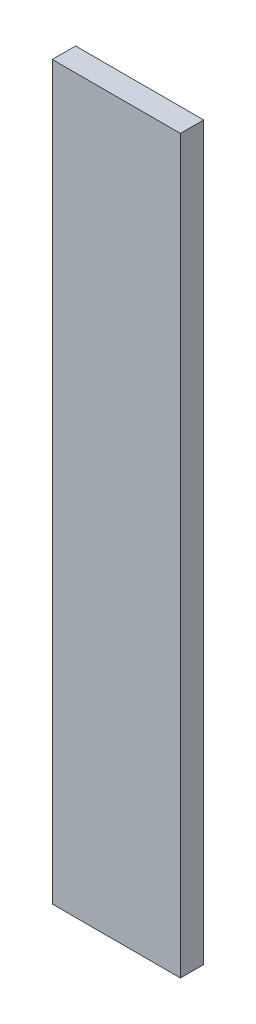
from build123d import *

# Parameters (mm, degrees)
SKETCH1_W                       = 39
SKETCH1_H                       = 155
BOSS_EXTRUDE1_DEPTH             = 2
BOSS_EXTRUDE2_DEPTH             = 78
SKETCH3_W                       = 2
SKETCH3_H                       = 2
BOSS_EXTRUDE3_DEPTH             = 78
SKETCH4_W                       = 2
SKETCH4_H                       = 2
BOSS_EXTRUDE4_DEPTH             = 151
SKETCH6_W                       = 35
SKETCH6_H                       = 2.2
CUT_EXTRUDE1_DEPTH              = 174.750539568
SKETCH7_W                       = 35
SKETCH7_H                       = 2.2
CUT_EXTRUDE2_DEPTH              = 112.671392935
SKETCH5_W                       = 31
SKETCH5_H                       = 2
BOSS_EXTRUDE5_DEPTH             = 2
BOSS_EXTRUDE6_REACH             = 115.077
SKETCH8_W                       = 2
SKETCH8_H                       = 2
BOSS_EXTRUDE6_DIRECTION_2_REACH = 115.077
SKETCH10_W                      = 2
SKETCH10_H                      = 2.2
SKETCH10_W_2                    = 2.2
SKETCH10_H_2                    = 2
BOSS_EXTRUDE8_DEPTH             = 2
SKETCH11_W                      = 2
SKETCH11_H                      = 2.2
SKETCH11_W_2                    = 2.2
SKETCH11_H_2                    = 2
BOSS_EXTRUDE9_DEPTH             = 2
FILLET2_R                       = 2.5
SKETCH14_W                      = 36.5
SKETCH14_H                      = 7.75
BOSS_EXTRUDE10_DEPTH            = 2
SKETCH13_W                      = 31
SKETCH13_H                      = 3
CUT_EXTRUDE4_DEPTH              = 2
FILLET3_R                       = 2
FILLET4_R                       = 0.5
SKETCH15_R                      = 5.1
CUT_EXTRUDE5_DEPTH              = 114.077407116
SKETCH16_R                      = 7.1
BOSS_EXTRUDE11_DEPTH            = 1
FILLET5_R                       = 0.5
FILLET7_R                       = 0.5
CUT_EXTRUDE7_DEPTH              = 114.077407116
CUT_EXTRUDE7_DEPTH_BACK         = 114.077407116
SKETCH18_W                      = 9
SKETCH18_H                      = 71
CUT_EXTRUDE8_DEPTH              = 113.323194399
CUT_EXTRUDE9_DEPTH              = 81.213776872
CUT_EXTRUDE9_DEPTH_BACK         = 81.213776872
SKETCH19_W                      = 11
SKETCH19_H                      = 8.2


with BuildPart() as part:
    # Sketch1 → Boss-Extrude1 (new body)
    with BuildSketch(Plane(origin=(0, 0, 0), x_dir=(1, 0, 0), z_dir=(0, 1, 0))):
        Rectangle(SKETCH1_W, SKETCH1_H)
    extrude(amount=BOSS_EXTRUDE1_DEPTH)

    # Sketch2 → Boss-Extrude2 (add)
    with BuildSketch(Plane(origin=(0, 2, 0), x_dir=(1, 0, 0), z_dir=(0, 1, 0))):
        Polygon((-17.5, -77.5), (-17.5, -75.5), (-17.5, 75.5), (17.5, 75.5), (17.5, -75.5), (17.5, -77.5), (19.5, -77.5), (19.5, 77.5), (-19.5, 77.5), (-19.5, -77.5), align=None)
    extrude(amount=BOSS_EXTRUDE2_DEPTH)

    # Sketch3 → Boss-Extrude3 (add)
    with BuildSketch(Plane(origin=(0, 2, 0), x_dir=(1, 0, 0), z_dir=(0, 1, 0))):
        with Locations((-16.5, -76.5)):
            Rectangle(SKETCH3_W, SKETCH3_H)
        with Locations((-16.5, -72.3)):
            Rectangle(SKETCH3_W, SKETCH3_H)
        with Locations((16.5, -76.5)):
            Rectangle(SKETCH3_W, SKETCH3_H)
        with Locations((16.5, -72.3)):
            Rectangle(SKETCH3_W, SKETCH3_H)
    extrude(amount=BOSS_EXTRUDE3_DEPTH)

    # Sketch4 → Boss-Extrude4 (add)
    with BuildSketch(Plane.XY.offset(-75.5)):
        with Locations((-16.5, 79)):
            Rectangle(SKETCH4_W, SKETCH4_H)
        Polygon((-15.5, 73.8), (-17.5, 71.8), (-17.5, 75.8), (-15.5, 75.8), align=None)
        Polygon((15.5, 75.8), (17.5, 75.8), (17.5, 71.8), (15.5, 73.8), align=None)
        with Locations((16.5, 79)):
            Rectangle(SKETCH4_W, SKETCH4_H)
    extrude(amount=BOSS_EXTRUDE4_DEPTH)

    # Sketch6 → Cut-Extrude1 (cut, through all)
    with BuildSketch(Plane.XY.offset(-75.5)):
        with Locations((0, 76.9)):
            Rectangle(SKETCH6_W, SKETCH6_H)
    extrude(amount=CUT_EXTRUDE1_DEPTH, mode=Mode.SUBTRACT)

    # Sketch7 → Cut-Extrude2 (cut, through all)
    with BuildSketch(Plane(origin=(0, 2, 0), x_dir=(1, 0, 0), z_dir=(0, 1, 0))):
        with Locations((0, -74.4)):
            Rectangle(SKETCH7_W, SKETCH7_H)
    extrude(amount=CUT_EXTRUDE2_DEPTH, mode=Mode.SUBTRACT)

    # Sketch5 → Boss-Extrude5 (add)
    with BuildSketch(Plane(origin=(0, 2, 0), x_dir=(1, 0, 0), z_dir=(0, 1, 0))):
        with Locations((0, -76.5)):
            Rectangle(SKETCH5_W, SKETCH5_H)
        with Locations((0, -72.3)):
            Rectangle(SKETCH5_W, SKETCH5_H)
    extrude(amount=BOSS_EXTRUDE5_DEPTH)

    # Boss-Extrude6: up to this face of the body (flat: up to its plane)
    boss_extrude6_end = Plane(part.part.faces().sort_by_distance((17.5, 36.9, -2.1))[0])
    # Sketch8 → Boss-Extrude6 (add, up to the picked face)
    with BuildSketch(Plane(origin=(0, 0, 0), x_dir=(0, 0, -1), z_dir=(1, 0, 0)), mode=Mode.PRIVATE) as boss_extrude6_sk1:
        with Locations((74.5, 79)):
            Rectangle(SKETCH8_W, SKETCH8_H)
    boss_extrude6_tool1 = split(extrude(boss_extrude6_sk1.sketch, amount=BOSS_EXTRUDE6_REACH, mode=Mode.PRIVATE), bisect_by=boss_extrude6_end, keep=Keep.BOTH, mode=Mode.PRIVATE)
    # Sketch8 → Boss-Extrude6 (add, up to the picked face)
    with BuildSketch(Plane(origin=(0, 0, 0), x_dir=(0, 0, -1), z_dir=(1, 0, 0)), mode=Mode.PRIVATE) as boss_extrude6_sk2:
        Polygon((75.5, 75.8), (73.5, 75.8), (73.5, 73.8), (75.5, 71.8), align=None)
    boss_extrude6_tool2 = split(extrude(boss_extrude6_sk2.sketch, amount=BOSS_EXTRUDE6_REACH, mode=Mode.PRIVATE), bisect_by=boss_extrude6_end, keep=Keep.BOTH, mode=Mode.PRIVATE)
    add(boss_extrude6_tool1.solids().sort_by(Axis((0, 79, -74.5), (1, 0, 0)))[0])
    add(boss_extrude6_tool2.solids().sort_by(Axis((0, 74.244444, -74.611111), (1, 0, 0)))[0])

    # Boss-Extrude6 direction 2: up to this face of the body (flat: up to its plane)
    boss_extrude6_direction_2_end = Plane(part.part.faces().sort_by_distance((-17.5, 36.9, -2.1))[0])
    # Sketch8 → Boss-Extrude6 direction 2 (add, up to the picked face)
    with BuildSketch(Plane(origin=(0, 0, 0), x_dir=(0, 0, -1), z_dir=(1, 0, 0)), mode=Mode.PRIVATE) as boss_extrude6_direction_2_sk1:
        with Locations((74.5, 79)):
            Rectangle(SKETCH8_W, SKETCH8_H)
    boss_extrude6_direction_2_tool1 = split(extrude(boss_extrude6_direction_2_sk1.sketch, amount=-BOSS_EXTRUDE6_DIRECTION_2_REACH, mode=Mode.PRIVATE), bisect_by=boss_extrude6_direction_2_end, keep=Keep.BOTH, mode=Mode.PRIVATE)
    # Sketch8 → Boss-Extrude6 direction 2 (add, up to the picked face)
    with BuildSketch(Plane(origin=(0, 0, 0), x_dir=(0, 0, -1), z_dir=(1, 0, 0)), mode=Mode.PRIVATE) as boss_extrude6_direction_2_sk2:
        Polygon((75.5, 75.8), (73.5, 75.8), (73.5, 73.8), (75.5, 71.8), align=None)
    boss_extrude6_direction_2_tool2 = split(extrude(boss_extrude6_direction_2_sk2.sketch, amount=-BOSS_EXTRUDE6_DIRECTION_2_REACH, mode=Mode.PRIVATE), bisect_by=boss_extrude6_direction_2_end, keep=Keep.BOTH, mode=Mode.PRIVATE)
    add(boss_extrude6_direction_2_tool1.solids().sort_by(Axis((0, 79, -74.5), (-1, 0, 0)))[0])
    add(boss_extrude6_direction_2_tool2.solids().sort_by(Axis((0, 74.244444, -74.611111), (-1, 0, 0)))[0])

    # Sketch10 → Boss-Extrude8 (add)
    with BuildSketch(Plane(origin=(-17.5, 0, 0), x_dir=(0, 0, -1), z_dir=(1, 0, 0))):
        with Locations((-76.5, 76.9)):
            Rectangle(SKETCH10_W, SKETCH10_H)
        with Locations((-74.4, 79)):
            Rectangle(SKETCH10_W_2, SKETCH10_H_2)
    extrude(amount=BOSS_EXTRUDE8_DEPTH)

    # Sketch11 → Boss-Extrude9 (add)
    with BuildSketch(Plane.ZY.offset(-17.5)):
        with Locations((76.5, 76.9)):
            Rectangle(SKETCH11_W, SKETCH11_H)
        with Locations((74.4, 79)):
            Rectangle(SKETCH11_W_2, SKETCH11_H_2)
    extrude(amount=BOSS_EXTRUDE9_DEPTH)

    # Fillet2
    fillet2_edges = [part.edges().sort_by_distance(p)[0] for p in [
        (-17.5, 36.9, 71.3),
        (17.5, 36.9, 71.3),
        (19.5, 40, 77.5),
        (-19.5, 40, 77.5),
        (-19.5, 40, -77.5),
        (-17.5, 36.9, -75.5),
        (17.5, 36.9, -75.5),
        (19.5, 40, -77.5),
        (19.5, 80, 0),
        (-19.5, 80, 0),
        (19.5, 0, 0),
        (-19.5, 0, 0),
        (0, 80, -77.5),
        (0, 0, 77.5),
        (0, 0, -77.5),
        (-17.5, 80, 77.5),
        (17.5, 80, 77.5),
    ]]
    fillet(fillet2_edges, radius=FILLET2_R)

    # Sketch14 → Boss-Extrude10 (add)
    with BuildSketch(Plane.XY.offset(-75.5)):
        with Locations((0, 5.125)):
            Rectangle(SKETCH14_W, SKETCH14_H)
    extrude(amount=BOSS_EXTRUDE10_DEPTH)

    # Sketch13 → Cut-Extrude4 (cut)
    with BuildSketch(Plane(origin=(0, 0, -77.5), x_dir=(-1, 0, 0), z_dir=(0, 0, -1))):
        with Locations((0, 5.5)):
            Rectangle(SKETCH13_W, SKETCH13_H)
    extrude(amount=-CUT_EXTRUDE4_DEPTH, mode=Mode.SUBTRACT)

    # Fillet3
    fillet3_edges = [part.edges().sort_by_distance(p)[0] for p in [
        (0, 9, -73.5),
    ]]
    fillet(fillet3_edges, radius=FILLET3_R - 0.0001)  # a hair under: the kernel refuses the full size

    # Fillet4
    fillet4_edges = [part.edges().sort_by_distance(p)[0] for p in [
        (15.5, 5.5, -75.5),
        (15.5, 4, -76.5),
        (0, 7, -75.5),
        (15.5, 7, -76.5),
        (-15.5, 5.5, -75.5),
        (-15.5, 7, -76.5),
        (0, 4, -75.5),
        (-15.5, 4, -76.5),
        (15.5, 5.5, -77.5),
        (0, 4, -77.5),
        (-15.5, 5.5, -77.5),
        (0, 7, -77.5),
    ]]
    fillet(fillet4_edges, radius=FILLET4_R)

    # Sketch15 → Cut-Extrude5 (cut, through all)
    with BuildSketch(Plane.XZ):
        with Locations(Location((0, 38.75, 0), (0, 0, 270))):
            Circle(SKETCH15_R)
        with Locations(Location((0, -38.75, 0), (0, 0, 270))):
            Circle(SKETCH15_R)
    extrude(amount=-CUT_EXTRUDE5_DEPTH, mode=Mode.SUBTRACT)

    # Sketch16 → Boss-Extrude11 (add)
    with BuildSketch(Plane(origin=(0, 2, 0), x_dir=(1, 0, 0), z_dir=(0, 1, 0))):
        with Locations(Location((0, 38.75, 0), (0, 0, 270))):
            Circle(SKETCH16_R)
        with Locations(Location((0, -38.75, 0), (0, 0, 270))):
            Circle(SKETCH16_R)
    extrude(amount=BOSS_EXTRUDE11_DEPTH)

    # Fillet5
    fillet5_edges = [part.edges().sort_by_distance(p)[0] for p in [
        (0, 2, -45.85),
        (0, 3, -45.85),
        (0, 2, 31.65),
        (0, 3, 31.65),
    ]]
    fillet(fillet5_edges, radius=FILLET5_R - 0.0001)  # a hair under: the kernel refuses the full size

    # Fillet7
    fillet7_edges = [part.edges().sort_by_distance(p)[0] for p in [
        (15.5, 80, 0.75),
        (0, 4, 77.5),
        (0, 80, -73.5),
        (-15.5, 80, 0.75),
        (-15.5, 40.75, 77.5),
        (-15.5, 79.267766953, 76.767766953),
        (15.5, 40.75, 77.5),
        (15.5, 79.267766953, 76.767766953),
    ]]
    fillet(fillet7_edges, radius=FILLET7_R)

    # Sketch17 → Cut-Extrude7 (cut, two sides: drawn at the far end of the back side and taken through both)
    with BuildSketch(Plane.XY.offset(-CUT_EXTRUDE7_DEPTH_BACK)):
        Polygon((19.5, 80), (14.5, 80), (14.5, 9), (0, 9), (0, 0), (19.5, 0), align=None)
        Polygon((-14.5, 9), (-14.5, 80), (-19.5, 80), (-19.5, 0), (0, 0), (0, 9), align=None)
    extrude(amount=CUT_EXTRUDE7_DEPTH + CUT_EXTRUDE7_DEPTH_BACK, mode=Mode.SUBTRACT)

    # Sketch18 → Cut-Extrude8 (cut, through all)
    with BuildSketch(Plane.XY):
        with Locations((10, 44.5)):
            Rectangle(SKETCH18_W, SKETCH18_H)
        with Locations((-10, 44.5)):
            Rectangle(SKETCH18_W, SKETCH18_H)
    extrude(amount=-CUT_EXTRUDE8_DEPTH, mode=Mode.SUBTRACT)

    # Sketch19 → Cut-Extrude9 (cut, two sides: drawn at the far end of the back side and taken through both)
    with BuildSketch(Plane.XY.offset(-75.5).offset(-CUT_EXTRUDE9_DEPTH_BACK)):
        with Locations((0, 75.9)):
            Rectangle(SKETCH19_W, SKETCH19_H)
    extrude(amount=CUT_EXTRUDE9_DEPTH + CUT_EXTRUDE9_DEPTH_BACK, mode=Mode.SUBTRACT)


solid = part.part
